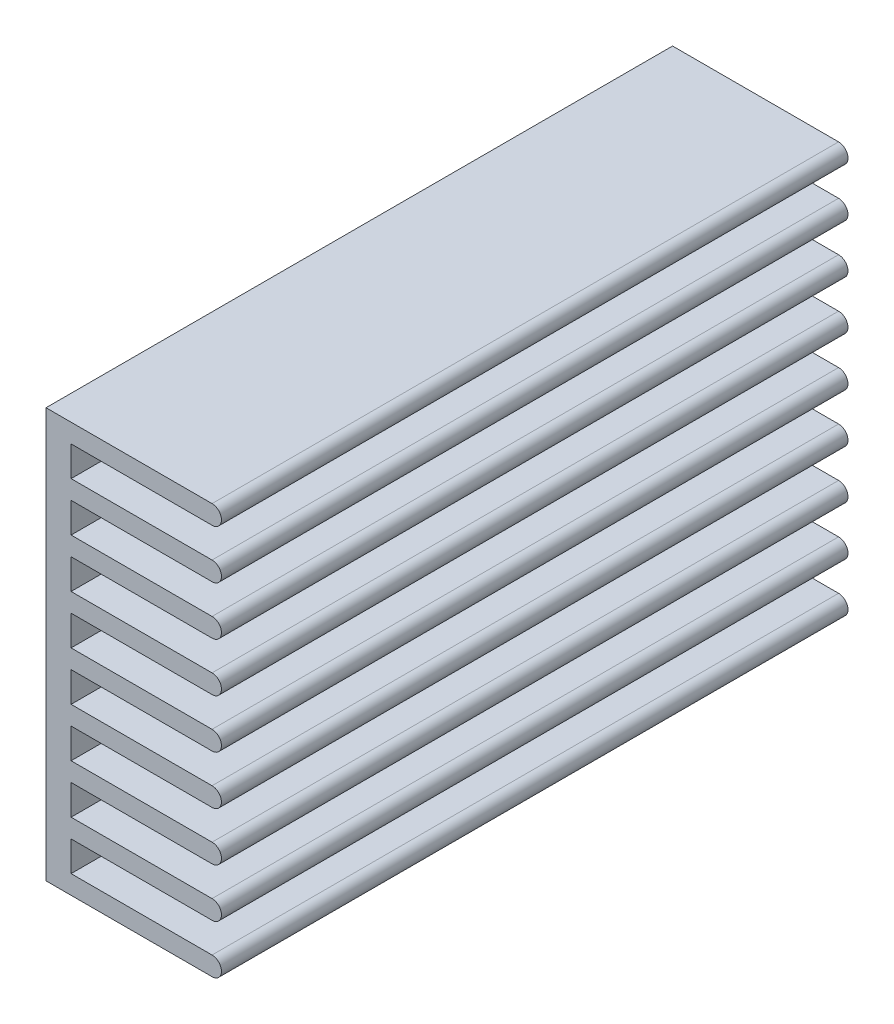
from build123d import *

# Parameters (mm, degrees)
DODANIE_WYCI_GNI_CIE1_DEPTH = 50


with BuildPart() as part:
    # Szkic1 → Dodanie-wyciągnięcie1 (new body)
    with BuildSketch(Plane.XY):
        with BuildLine():
            Line((13.25, 1.5), (2, 1.5))
            Line((2, 1.5), (2, 3.9))
            Line((2, 3.9), (13.25, 3.9))
            ThreePointArc((13.25, 3.9), (14, 4.65), (13.25, 5.4))
            Line((13.25, 5.4), (2, 5.4))
            Line((2, 5.4), (2, 7.8))
            Line((2, 7.8), (13.25, 7.8))
            ThreePointArc((13.25, 7.8), (14, 8.55), (13.25, 9.3))
            Line((13.25, 9.3), (2, 9.3))
            Line((2, 9.3), (2, 11.7))
            Line((2, 11.7), (13.25, 11.7))
            ThreePointArc((13.25, 11.7), (14, 12.45), (13.25, 13.2))
            Line((13.25, 13.2), (2, 13.2))
            Line((2, 13.2), (2, 15.6))
            Line((2, 15.6), (13.25, 15.6))
            ThreePointArc((13.25, 15.6), (14, 16.35), (13.25, 17.1))
            Line((13.25, 17.1), (2, 17.1))
            Line((2, 17.1), (2, 19.5))
            Line((2, 19.5), (13.25, 19.5))
            ThreePointArc((13.25, 19.5), (14, 20.25), (13.25, 21))
            Line((13.25, 21), (2, 21))
            Line((2, 21), (2, 23.4))
            Line((2, 23.4), (13.25, 23.4))
            ThreePointArc((13.25, 23.4), (14, 24.15), (13.25, 24.9))
            Line((13.25, 24.9), (2, 24.9))
            Line((2, 24.9), (2, 27.3))
            Line((2, 27.3), (13.25, 27.3))
            ThreePointArc((13.25, 27.3), (14, 28.05), (13.25, 28.8))
            Line((13.25, 28.8), (2, 28.8))
            Line((2, 28.8), (2, 31.2))
            Line((2, 31.2), (13.25, 31.2))
            ThreePointArc((13.25, 31.2), (14, 31.95), (13.25, 32.7))
            Line((13.25, 32.7), (0, 32.7))
            Line((0, 32.7), (0, 0))
            Line((0, 0), (13.25, 0))
            ThreePointArc((13.25, 0), (14, 0.75), (13.25, 1.5))
        make_face()
    extrude(amount=DODANIE_WYCI_GNI_CIE1_DEPTH)


solid = part.part
